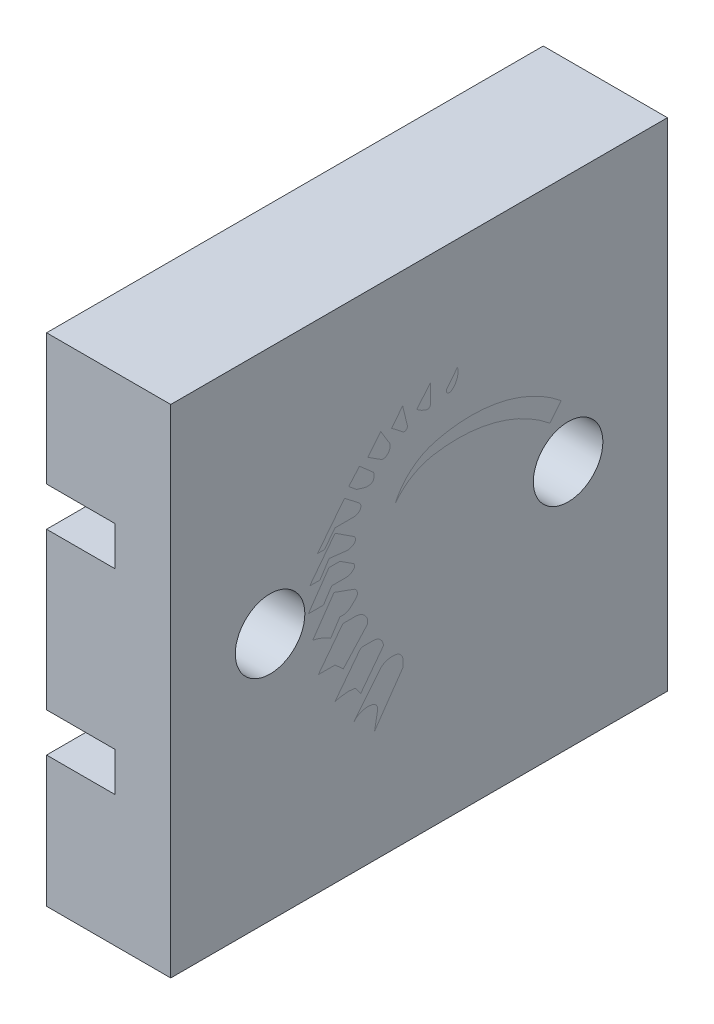
from build123d import *

# Parameters (mm, degrees)
SKETCH1_W                     = 12.7
SKETCH1_H                     = 12.7
BOSS_EXTRUDE1_DEPTH           = 3.175
SKETCH2_R                     = 1.190625
CUT_EXTRUDE1_DEPTH            = 12
SKETCH3_R                     = 2
CUT_EXTRUDE2_DEPTH            = 2
TAP_DRILL_FOR_2_56_TAP1_D     = 1.778
TAP_DRILL_FOR_2_56_TAP1_DEPTH = 12.45
TAP_DRILL_FOR_2_56_TAP1_TIP   = 0.53416509
SKETCH5_W                     = 1.75
SKETCH5_H                     = 1
CUT_EXTRUDE3_DEPTH            = 15.549677831


with BuildPart() as part:
    # Sketch1 → Boss-Extrude1 (new body)
    with BuildSketch(Plane(origin=(0, 0, 0), x_dir=(0, 0, -1), z_dir=(1, 0, 0))):
        Rectangle(SKETCH1_W, SKETCH1_H)
    extrude(amount=BOSS_EXTRUDE1_DEPTH)

    # Sketch2 → Cut-Extrude1 (cut)
    with BuildSketch(Plane.XZ.offset(6.35)):
        Circle(SKETCH2_R)
    extrude(amount=-CUT_EXTRUDE1_DEPTH, mode=Mode.SUBTRACT)

    # Sketch3 → Cut-Extrude2 (cut)
    with BuildSketch(Plane.XZ.offset(6.35)):
        Circle(SKETCH3_R)
    extrude(amount=-CUT_EXTRUDE2_DEPTH, mode=Mode.SUBTRACT)

    # Tap Drill for #2-56 Tap1
    with Locations(Plane(origin=(0, 0, -3.81), x_dir=(0, 0, -1), z_dir=(-1, 0, 0))):
        with Locations((0, 0), (-7.62, 0)):
            Hole(TAP_DRILL_FOR_2_56_TAP1_D / 2, depth=TAP_DRILL_FOR_2_56_TAP1_DEPTH)
            with Locations((0, 0, -(TAP_DRILL_FOR_2_56_TAP1_DEPTH + TAP_DRILL_FOR_2_56_TAP1_TIP / 2))):  # 118° drill point
                Cone(0, TAP_DRILL_FOR_2_56_TAP1_D / 2, TAP_DRILL_FOR_2_56_TAP1_TIP, mode=Mode.SUBTRACT)

    # Sketch5 → Cut-Extrude3 (cut, through all)
    with BuildSketch(Plane.XY.offset(6.35)):
        with Locations((0.875, 2.5)):
            Rectangle(SKETCH5_W, SKETCH5_H)
        with Locations((0.875, -2.5)):
            Rectangle(SKETCH5_W, SKETCH5_H)
    extrude(amount=-CUT_EXTRUDE3_DEPTH, mode=Mode.SUBTRACT)


solid = part.part
